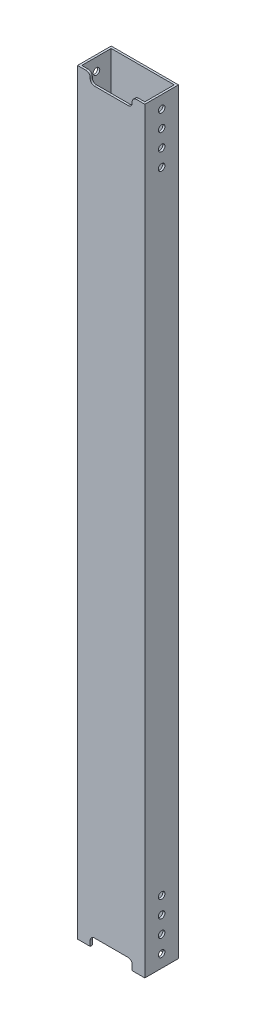
from build123d import *

# Parameters (mm, degrees)
SKETCH1_W           = 50.8
SKETCH1_H           = 571.5
BOSS_EXTRUDE1_DEPTH = 12.7
SHELL1_T            = -1.5875
SKETCH5_W           = 31.75
SKETCH5_H           = 26.9875
CUT_EXTRUDE4_DEPTH  = 288.157643987
FILLET2_R           = 3.175
SKETCH3_R           = 2.4892
CUT_EXTRUDE5_DEPTH  = 288.157643987
MIRROR2_START       = 11.1125
MIRROR2_DEPTH       = 1.5875
MIRROR2_START_2     = -25.4
MIRROR2_2_OUTLINE_R = 2.4892
MIRROR2_2_DEPTH     = 50.8


# Read off the part's stored shape, not the designer's step: Mirror2
with BuildPart() as part:
    # Sketch1 → Boss-Extrude1 (new, symmetric)
    with BuildSketch(Plane.XY):
        Rectangle(SKETCH1_W, SKETCH1_H)
    extrude(amount=BOSS_EXTRUDE1_DEPTH, both=True)

    # Shell1
    shell1_openings = [part.faces().sort_by_distance(p)[0] for p in [
        (0, -285.75, 0),
        (0, 285.75, 0),
    ]]
    offset(amount=SHELL1_T, openings=shell1_openings, kind=Kind.INTERSECTION)

    # Sketch5 → Cut-Extrude4 (cut, through all)
    with BuildSketch(Plane.XY):
        with Locations((0, 292.1)):
            Rectangle(SKETCH5_W, SKETCH5_H)
    extrude(amount=CUT_EXTRUDE4_DEPTH, mode=Mode.SUBTRACT)

    # Fillet2
    fillet2_edges = [part.edges().sort_by_distance(p)[0] for p in [
        (15.875, 278.60625, 11.90625),
        (15.875, 285.75, 11.90625),
        (-15.875, 285.75, 11.90625),
        (-15.875, 278.60625, 11.90625),
    ]]
    fillet(fillet2_edges, radius=FILLET2_R)

    # Sketch3 → Cut-Extrude5 (cut, symmetric)
    with BuildSketch(Plane(origin=(0, 0, 0), x_dir=(0, 0, -1), z_dir=(1, 0, 0))):
        with Locations((0, 276.225)):
            Circle(SKETCH3_R)
        with Locations((0, 263.525)):
            Circle(SKETCH3_R)
        with Locations((0, 250.825)):
            Circle(SKETCH3_R)
        with Locations((0, 238.125)):
            Circle(SKETCH3_R)
    extrude(amount=CUT_EXTRUDE5_DEPTH, both=True, mode=Mode.SUBTRACT)

    # Mirror2 outline → Mirror2 (cut)
    with BuildSketch(Plane.XY.offset(MIRROR2_START)):
        with BuildLine():
            Line((-15.875, -285.75), (15.875, -285.75))
            Line((15.875, -285.75), (15.875, -281.78125))
            ThreePointArc((15.875, -281.78125), (14.94506403, -279.53618597), (12.7, -278.60625))
            Line((12.7, -278.60625), (-12.7, -278.60625))
            ThreePointArc((-12.7, -278.60625), (-14.94506403, -279.53618597), (-15.875, -281.78125))
            Line((-15.875, -281.78125), (-15.875, -285.75))
        make_face()
    extrude(amount=MIRROR2_DEPTH, mode=Mode.SUBTRACT)

    # Mirror2 2 outline → Mirror2 2 (cut)
    with BuildSketch(Plane.YZ.offset(MIRROR2_START_2)):
        with Locations((-238.125, 0)):
            Circle(MIRROR2_2_OUTLINE_R)
        with Locations((-250.825, 0)):
            Circle(MIRROR2_2_OUTLINE_R)
        with Locations((-263.525, 0)):
            Circle(MIRROR2_2_OUTLINE_R)
        with Locations((-276.225, 0)):
            Circle(MIRROR2_2_OUTLINE_R)
    extrude(amount=MIRROR2_2_DEPTH, mode=Mode.SUBTRACT)


solid = part.part
